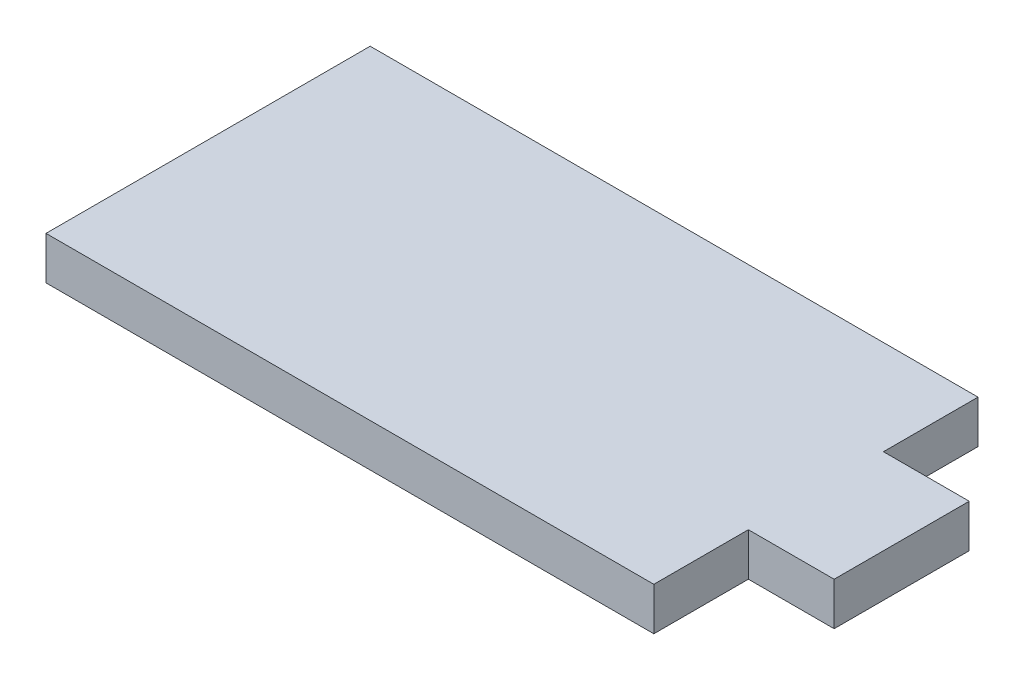
from build123d import *

# Parameters (mm, degrees)
BOSS_EXTRUDE1_DEPTH = 3.175


with BuildPart() as part:
    # Sketch1 → Boss-Extrude1 (new body)
    with BuildSketch(Plane(origin=(0, 0, 0), x_dir=(1, 0, 0), z_dir=(0, 1, 0))):
        Polygon((22.5, 7), (-22.5, 7), (-22.5, 0), (-22.5, -10), (-22.5, -17), (22.5, -17), (22.5, -10), (28.85, -10), (28.85, 0), (22.5, 0), align=None)
    extrude(amount=BOSS_EXTRUDE1_DEPTH)


solid = part.part
